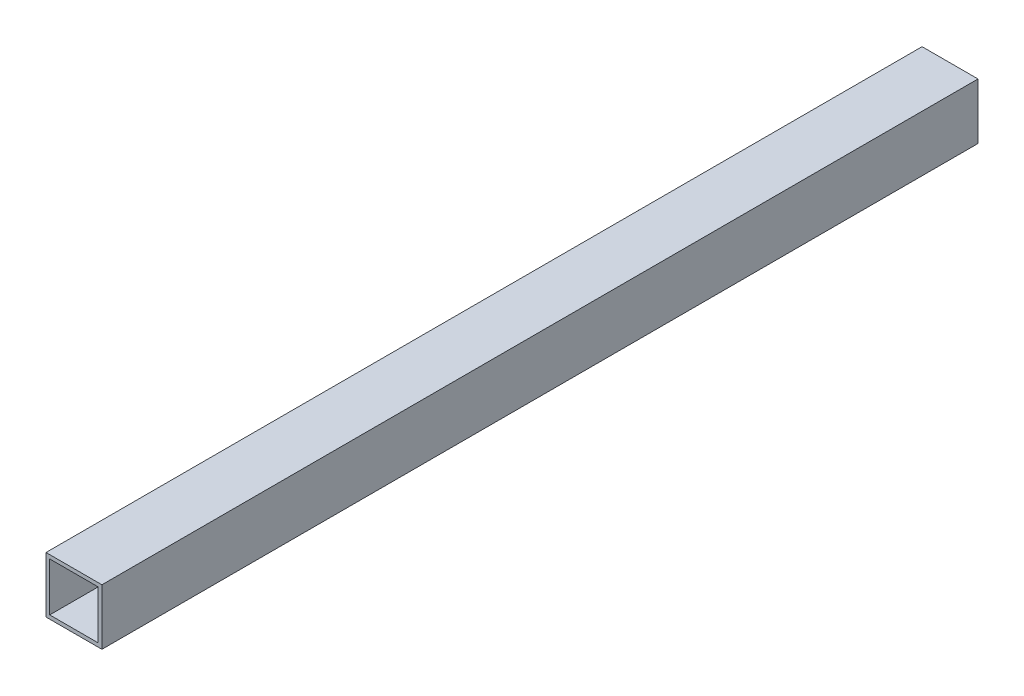
from build123d import *

# Parameters (mm, degrees)
SKETCH_1_W      = 15
SKETCH_1_H      = 15
SKETCH_1_W_2    = 13
SKETCH_1_H_2    = 13
EXTRUDE_1_DEPTH = 235


with BuildPart() as part:
    # 草图1 → 拉伸-薄壁1 (new body)
    with BuildSketch(Plane.XY):
        with Locations((7.5, -7.5)):
            Rectangle(SKETCH_1_W, SKETCH_1_H)
        with Locations((7.5, -7.5)):
            Rectangle(SKETCH_1_W_2, SKETCH_1_H_2, mode=Mode.SUBTRACT)
    extrude(amount=EXTRUDE_1_DEPTH)


solid = part.part
